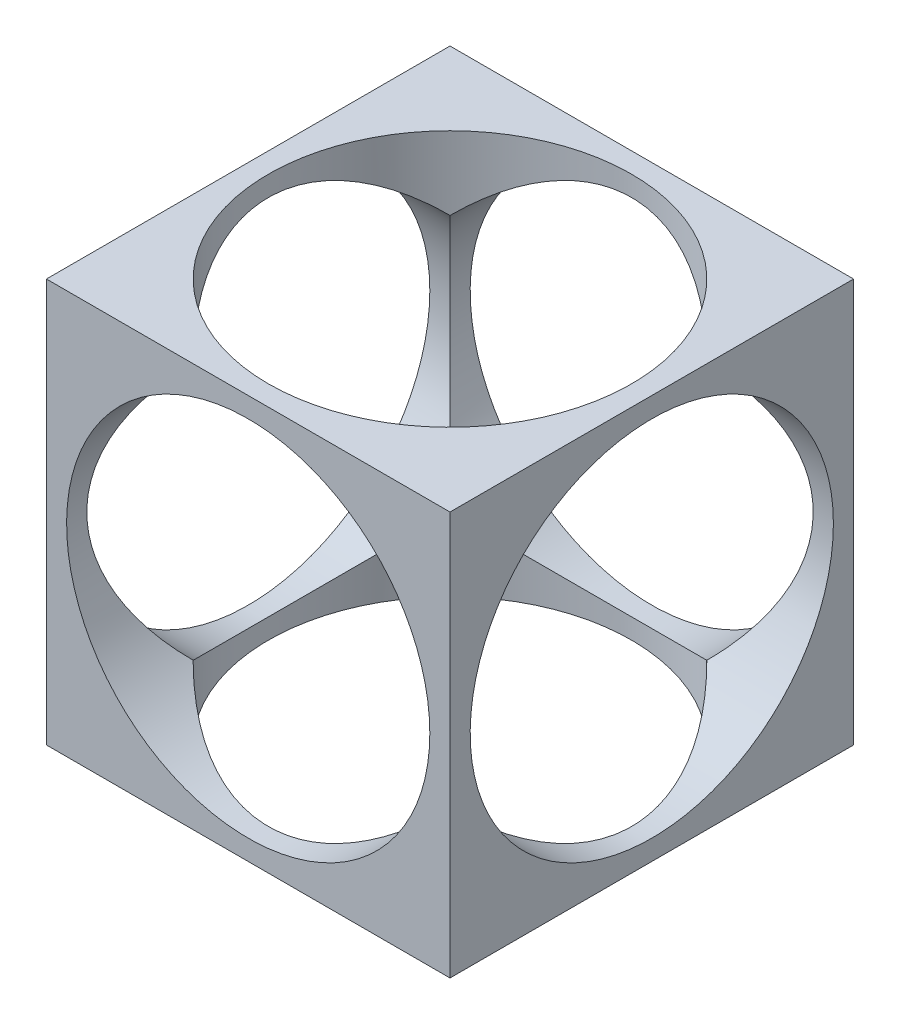
from build123d import *

# Parameters (mm, degrees)
SKETCH1_W          = 100
SKETCH1_H          = 100
EXTRUDE1_DEPTH     = 100
SKETCH2_R          = 45
CUT_EXTRUDE1_DEPTH = 174.205080757
SKETCH4_R          = 45
CUT_EXTRUDE2_DEPTH = 174.205080757
SKETCH5_R          = 45
CUT_EXTRUDE3_DEPTH = 174.205080757


with BuildPart() as part:
    # Sketch1 → Extrude1 (new body)
    with BuildSketch(Plane.XY):
        with Locations((50, 50)):
            Rectangle(SKETCH1_W, SKETCH1_H)
    extrude(amount=EXTRUDE1_DEPTH)

    # Sketch2 → Cut-Extrude1 (cut, through all)
    with BuildSketch(Plane(origin=(0, 0, 0), x_dir=(0, 0, -1), z_dir=(1, 0, 0))):
        with Locations((-50, 50)):
            Circle(SKETCH2_R)
    extrude(amount=CUT_EXTRUDE1_DEPTH, mode=Mode.SUBTRACT)

    # Sketch4 → Cut-Extrude2 (cut, through all)
    with BuildSketch(Plane(origin=(100, 0, 0), x_dir=(1, 0, 0), z_dir=(0, 0, 1))):
        with Locations((-50, 50)):
            Circle(SKETCH4_R)
    extrude(amount=CUT_EXTRUDE2_DEPTH, mode=Mode.SUBTRACT)

    # Sketch5 → Cut-Extrude3 (cut, through all)
    with BuildSketch(Plane(origin=(100, 0, 0), x_dir=(0, 0, -1), z_dir=(0, 1, 0))):
        with Locations((-50, 50)):
            Circle(SKETCH5_R)
    extrude(amount=CUT_EXTRUDE3_DEPTH, mode=Mode.SUBTRACT)


solid = part.part
